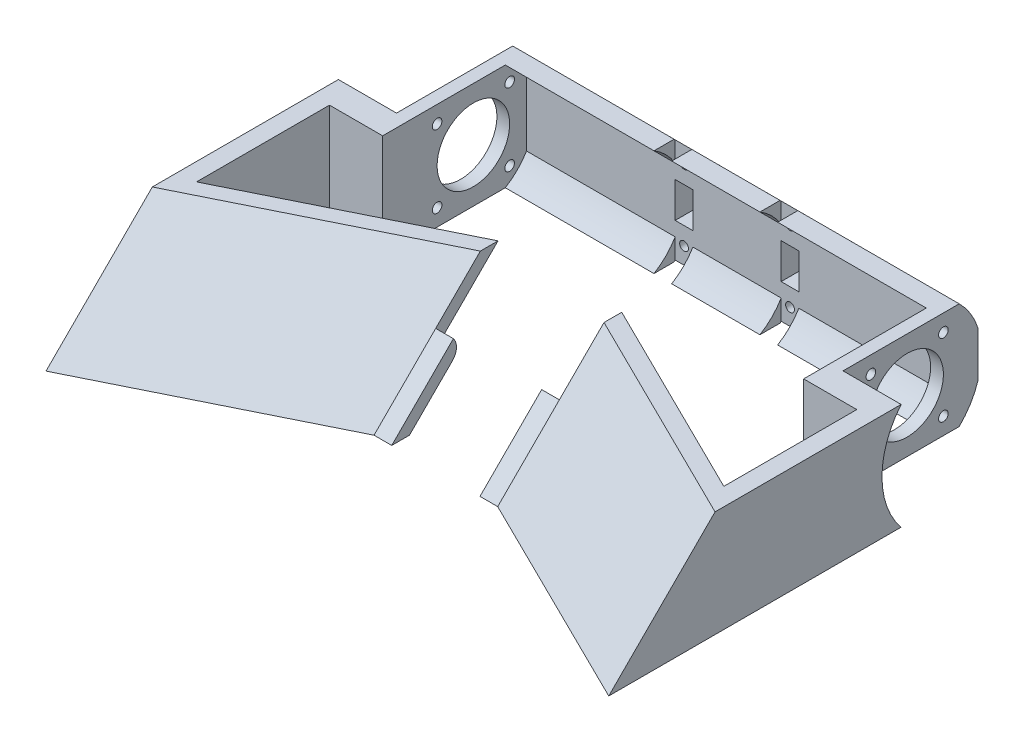
from build123d import *

# Parameters (mm, degrees)
SKETCH3_W               = 20.828
SKETCH3_H               = 6.35
SKETCH3_W_2             = 4.572
SKETCH3_H_2             = 45.212
SKETCH3_W_3             = 150.876
BOSS_EXTRUDE1_DEPTH     = 38.1
SKETCH5_R               = 1.7272
SKETCH5_R_2             = 13
CUT_EXTRUDE2_DEPTH      = 193.753075911
CUT_EXTRUDE3_DEPTH      = 193.753075911
BOSS_EXTRUDE2_DEPTH     = 155.448
CUT_EXTRUDE1_DEPTH      = 120.492895555
CUT_EXTRUDE1_DEPTH_BACK = 120.492895555
SKETCH4_R               = 1.5875
SKETCH8_R               = 29.845
CUT_EXTRUDE4_DEPTH      = 193.75307593
BOSS_EXTRUDE3_DEPTH     = 20.828
SKETCH10_W              = 6.35
SKETCH10_H              = 38.1
CUT_EXTRUDE5_DEPTH      = 120.492895586
BOSS_EXTRUDE4_DEPTH     = 6.35
BOSS_EXTRUDE5_DEPTH     = 6.35
FILLET1_R               = 5.08


# Read off the part's stored shape, not the designer's step: Mirror6
with BuildPart() as part:
    # Sketch3 → Boss-Extrude1 (new body)
    with BuildSketch(Plane(origin=(0, 0, 0), x_dir=(1, 0, 0), z_dir=(0, 1, 0))):
        with Locations((-90.424, -51.562)):
            Rectangle(SKETCH3_W, SKETCH3_H)
        with Locations((-77.724, -51.562)):
            Rectangle(SKETCH3_W_2, SKETCH3_H)
        with Locations((-77.724, -25.781)):
            Rectangle(SKETCH3_W_2, SKETCH3_H_2)
        with Locations((-77.724, 0)):
            Rectangle(SKETCH3_W_2, SKETCH3_H)
        Rectangle(SKETCH3_W_3, SKETCH3_H)
        with Locations((77.724, 0)):
            Rectangle(SKETCH3_W_2, SKETCH3_H)
        with Locations((77.724, -25.781)):
            Rectangle(SKETCH3_W_2, SKETCH3_H_2)
        with Locations((77.724, -51.562)):
            Rectangle(SKETCH3_W_2, SKETCH3_H)
        with Locations((90.424, -51.562)):
            Rectangle(SKETCH3_W, SKETCH3_H)
    extrude(amount=BOSS_EXTRUDE1_DEPTH)

    # Sketch5 → Cut-Extrude2 (cut, through all)
    with BuildSketch(Plane.ZY.offset(80.01)):
        with Locations((9.225, 32.05)):
            Circle(SKETCH5_R)
        with Locations((35.225, 32.05)):
            Circle(SKETCH5_R)
        with Locations((35.225, 6.05)):
            Circle(SKETCH5_R)
        with Locations((9.225, 6.05)):
            Circle(SKETCH5_R)
        with Locations((22.225, 19.05)):
            Circle(SKETCH5_R_2)
    extrude(amount=-CUT_EXTRUDE2_DEPTH, mode=Mode.SUBTRACT)

    # Sketch6 → Cut-Extrude3 (cut, through all)
    with BuildSketch(Plane.ZY.offset(80.01)):
        with BuildLine():
            Line((22.225, 45.72), (-24.944215418, 45.72))
            Line((-24.944215418, 45.72), (-24.944215418, -7.62))
            Line((-24.944215418, -7.62), (22.225, -7.62))
            ThreePointArc((22.225, -7.62), (-4.445, 19.05), (22.225, 45.72))
        make_face()
    extrude(amount=-CUT_EXTRUDE3_DEPTH, mode=Mode.SUBTRACT)

    # Sketch7 → Boss-Extrude2 (add)
    with BuildSketch(Plane.ZY.offset(80.01)):
        with BuildLine():
            Line((3.55988816, 38.1), (10.7773747, 38.1))
            ThreePointArc((10.7773747, 38.1), (0, 19.05), (10.7773747, 0))
            Line((10.7773747, 0), (3.55988816, 0))
            ThreePointArc((3.55988816, 0), (-0.473774796, 5.048052894), (-3.175, 10.918032218))
            Line((-3.175, 10.918032218), (-3.175, 27.181967782))
            ThreePointArc((-3.175, 27.181967782), (-0.473774796, 33.051947106), (3.55988816, 38.1))
        make_face()
    extrude(amount=-BOSS_EXTRUDE2_DEPTH)

    # Sketch4 → Cut-Extrude1 (cut, two sides: drawn at the far end of the back side and taken through both)
    with BuildSketch(Plane.XY.offset(3.175).offset(-CUT_EXTRUDE1_DEPTH_BACK)):
        Polygon((15.8115, 25.4), (15.8115, 19.05), (15.8115, 12.7), (22.1615, 12.7), (22.1615, 25.4), align=None)
        Polygon((-15.8115, 25.4), (-22.1615, 25.4), (-22.1615, 12.7), (-15.8115, 12.7), (-15.8115, 19.05), align=None)
        with Locations((-18.9865, 31.75)):
            Circle(SKETCH4_R)
        with Locations((-18.9865, 6.35)):
            Circle(SKETCH4_R)
        with Locations((18.9865, 6.35)):
            Circle(SKETCH4_R)
        with Locations((18.9865, 31.75)):
            Circle(SKETCH4_R)
    extrude(amount=CUT_EXTRUDE1_DEPTH + CUT_EXTRUDE1_DEPTH_BACK, mode=Mode.SUBTRACT)

    # Sketch8 → Cut-Extrude4 (cut, through all)
    with BuildSketch(Plane.ZY.offset(80.01)):
        with Locations((22.225, 19.05)):
            Circle(SKETCH8_R)
    cut_extrude4 = extrude(amount=CUT_EXTRUDE4_DEPTH, mode=Mode.SUBTRACT)

    # Sketch9 → Boss-Extrude3 (add)
    with BuildSketch(Plane.ZY.offset(80.01)):
        with BuildLine():
            Line((48.387, 38.1), (48.387, 33.412234541))
            ThreePointArc((48.387, 33.412234541), (46.904737017, 35.831972642), (45.199366694, 38.1))
            Line((45.199366694, 38.1), (48.387, 38.1))
        make_face()
        with BuildLine():
            Line((48.387, 0), (48.387, 4.687765459))
            ThreePointArc((48.387, 4.687765459), (46.904737017, 2.268027358), (45.199366694, 0))
            Line((45.199366694, 0), (48.387, 0))
        make_face()
    boss_extrude3 = extrude(amount=BOSS_EXTRUDE3_DEPTH)

    # Mirror4: Cut-Extrude4, Boss-Extrude3 across plane
    add(cut_extrude4.mirror(Plane(origin=(0, 0, 0), x_dir=(0, 0, 1), z_dir=(1, 0, 0))), mode=Mode.SUBTRACT)
    add(boss_extrude3.mirror(Plane(origin=(0, 0, 0), x_dir=(0, 0, 1), z_dir=(1, 0, 0))))

    # Sketch10 → Cut-Extrude5 (cut, through all)
    with BuildSketch(Plane.XY.offset(3.175)):
        with Locations((-18.9865, 19.05)):
            Rectangle(SKETCH10_W, SKETCH10_H)
        with Locations((18.9865, 19.05)):
            Rectangle(SKETCH10_W, SKETCH10_H)
    extrude(amount=CUT_EXTRUDE5_DEPTH, mode=Mode.SUBTRACT)

    # Sketch11 → Boss-Extrude4 (add)
    with BuildSketch(Plane.ZY.offset(100.838)):
        Polygon((143.637, 0), (105.537, 38.1), (54.737, 38.1), (54.737, 0), align=None)
    extrude(amount=-BOSS_EXTRUDE4_DEPTH)

    # Sweep1: sweep along a path in Sketch12
    with BuildLine(Plane.XZ) as sweep1_path:
        Line((-22.1615, 104.7573747), (-100.838, 143.637))
    # Sketch13 → Sweep1 (sweep)
    with BuildSketch(Plane.ZY.offset(100.838)):
        Polygon((143.637, 0), (149.987, 0), (111.887, 38.1), (105.537, 38.1), align=None)
    sweep(path=sweep1_path.line)

    # Sketch17 → Boss-Extrude5 (add)
    with BuildSketch(Plane(origin=(-22.1615, 0, 0), x_dir=(0, 0, -1), z_dir=(1, 0, 0))):
        Polygon((-82.6593747, 22.098), (-104.7573747, 0), (-111.1073747, 0), (-89.0093747, 22.098), align=None)
    extrude(amount=BOSS_EXTRUDE5_DEPTH)

    # Fillet1
    # the kernel refuses this fillet: 5.08 mm, written as the material it takes off along each edge
    with BuildSketch(Plane(origin=(-22.1615, 22.098, 82.6593747), x_dir=(0, -0.7071067811865456, 0.7071067811865492), z_dir=(1, 0, 0))) as fillet1_piece_1:
        with BuildLine():
            CenterArc((9.535764898, -5.08), FILLET1_R, 90, 83.331971404)
            Line((4.490128061, -4.490128061), (0, 0))
            Line((0, 0), (9.535764898, 0))
        make_face()
    extrude(amount=30.189412245, mode=Mode.SUBTRACT)

    # Mirror6: part across plane


with BuildPart() as part_1:
    add(part.part)
    add(part.part.mirror(Plane(origin=(0, 0, 0), x_dir=(0, 0, 1), z_dir=(1, 0, 0))))


solid = part_1.part
